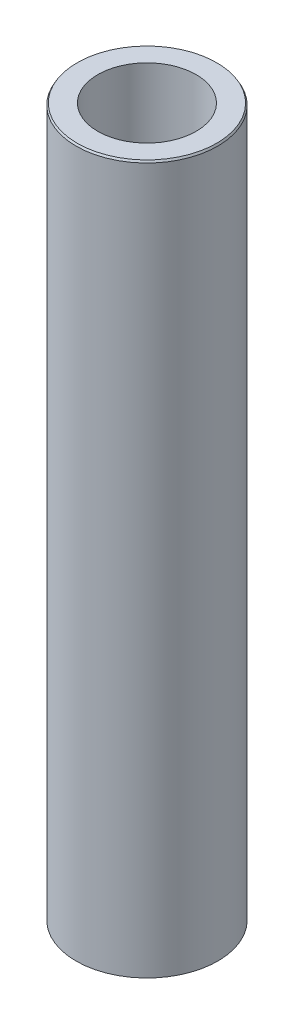
from build123d import *
from OCP.BRepFilletAPI import BRepFilletAPI_MakeChamfer

# Parameters (mm, degrees)
SKETCH1_R           = 60
BOSS_EXTRUDE1_DEPTH = 600
SKETCH2_R           = 41.633127917
CUT_EXTRUDE1_DEPTH  = 606.970296302
CHAMFER1_SIZE       = 1.61510975
CHAMFER1_SIZE2      = 0.932484049


with BuildPart() as part:
    # Sketch1 → Boss-Extrude1 (new body)
    with BuildSketch(Plane(origin=(0, 0, 0), x_dir=(1, 0, 0), z_dir=(0, 1, 0))):
        Circle(SKETCH1_R)
    extrude(amount=BOSS_EXTRUDE1_DEPTH)

    # Sketch2 → Cut-Extrude1 (cut, through all)
    with BuildSketch(Plane(origin=(0, 0, 0), x_dir=(1, 0, 0), z_dir=(0, 1, 0))):
        Circle(SKETCH2_R)
    extrude(amount=CUT_EXTRUDE1_DEPTH, mode=Mode.SUBTRACT)

    # Chamfer1: one chamfer whose edges measure the first distance from different faces: ONE call of the kernel's chamfer builder (chamfer() names one face for all edges)
    chamfer1_edges_1 = [part.edges().sort_by_distance(p)[0] for p in [
        (-60, 600, 0),
    ]]
    chamfer1_side_1 = [part.faces().sort_by_distance(p)[0] for p in [
        (-60, 300, 0),
    ]]
    chamfer1_edges_2 = [part.edges().sort_by_distance(p)[0] for p in [
        (-60, 0, 0),
    ]]
    chamfer1_side_2 = [part.faces().sort_by_distance(p)[0] for p in [
        (-58.302943725, 0, 0),
    ]]
    chamfer1 = BRepFilletAPI_MakeChamfer(part.part.solid().wrapped)
    for e in chamfer1_edges_1:
        chamfer1.Add(CHAMFER1_SIZE, CHAMFER1_SIZE2, e.wrapped, chamfer1_side_1[0].wrapped)  # the first distance lies on this face
    for e in chamfer1_edges_2:
        chamfer1.Add(CHAMFER1_SIZE, CHAMFER1_SIZE2, e.wrapped, chamfer1_side_2[0].wrapped)  # the first distance lies on this face
    add(Compound.cast(chamfer1.Shape()), mode=Mode.REPLACE)


solid = part.part
